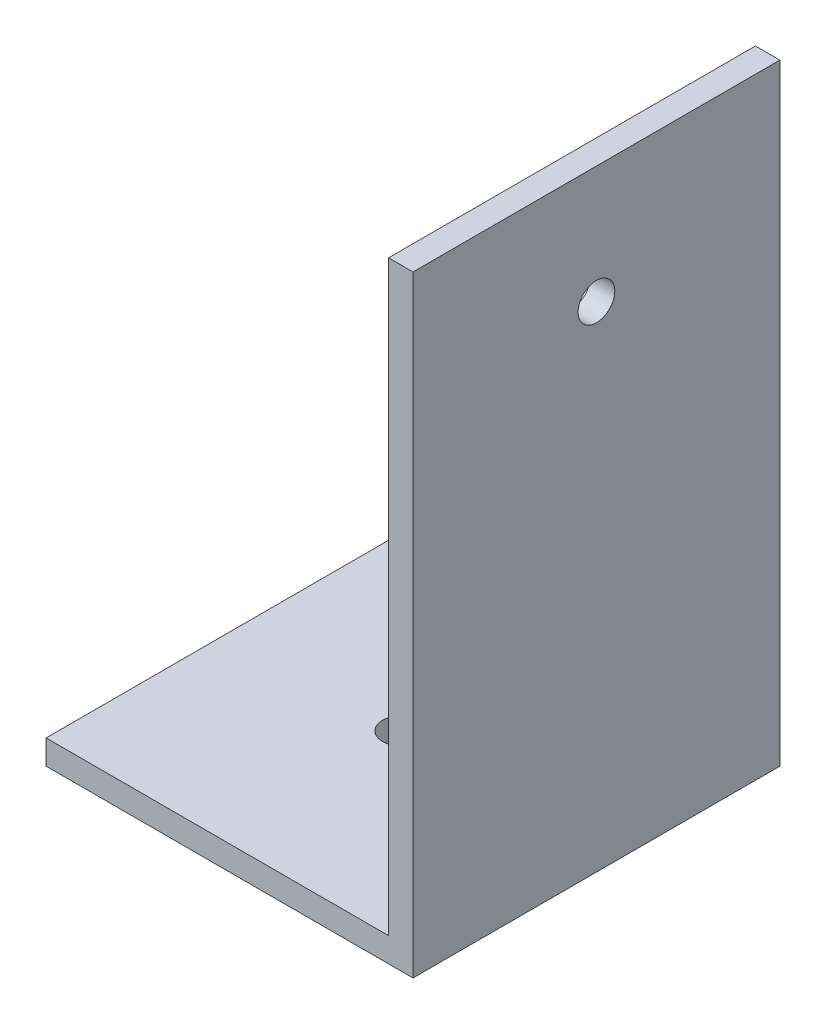
from build123d import *

# Parameters (mm, degrees)
ESTRUSIONE_ESTRUSIONE1_DEPTH = 30
SCHIZZO2_R                   = 1.5
TAGLIO_ESTRUSIONE1_DEPTH     = 65.683846515
SCHIZZO3_R                   = 1.5
TAGLIO_ESTRUSIONE2_DEPTH     = 65.062469512


with BuildPart() as part:
    # Schizzo1 → Estrusione-Estrusione1 (new body)
    with BuildSketch(Plane.XY):
        Polygon((0, 0), (-30, 0), (-30, 2), (-2, 2), (-2, 50), (0, 50), align=None)
    extrude(amount=ESTRUSIONE_ESTRUSIONE1_DEPTH)

    # Schizzo2 → Taglio-Estrusione1 (cut, through all)
    with BuildSketch(Plane.ZY.offset(2)):
        with Locations((15, 40.4)):
            Circle(SCHIZZO2_R)
    extrude(amount=-TAGLIO_ESTRUSIONE1_DEPTH, mode=Mode.SUBTRACT)

    # Schizzo3 → Taglio-Estrusione2 (cut, through all)
    with BuildSketch(Plane(origin=(0, 2, 0), x_dir=(1, 0, 0), z_dir=(0, 1, 0))):
        with Locations((-16, -15)):
            Circle(SCHIZZO3_R)
    extrude(amount=-TAGLIO_ESTRUSIONE2_DEPTH, mode=Mode.SUBTRACT)


solid = part.part
